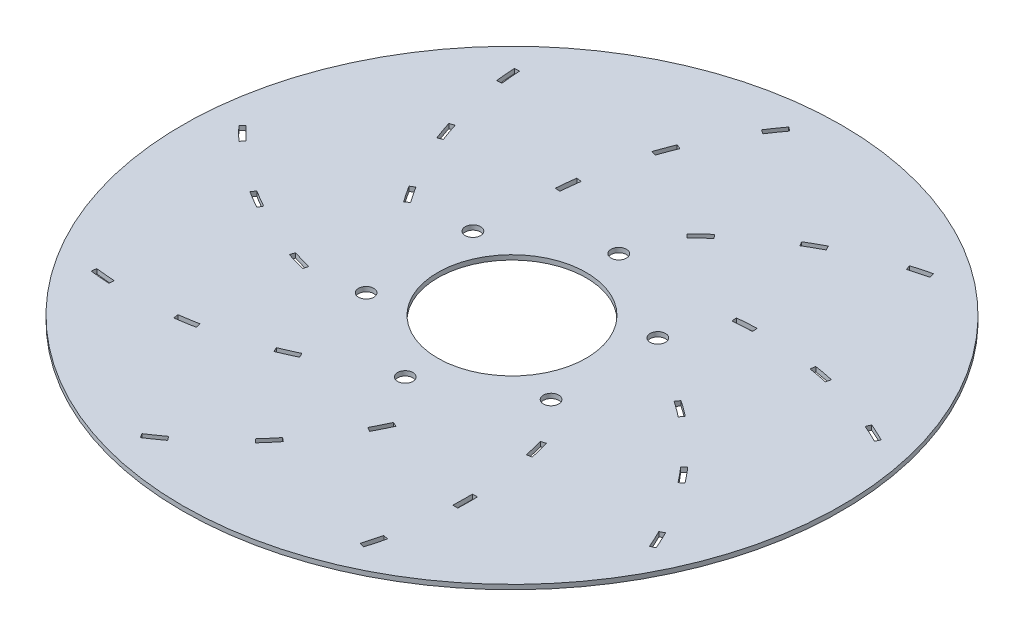
from build123d import *

# Parameters (mm, degrees)
SKETCH2_R                = 177.5
SKETCH2_R_2              = 40
SKETCH2_R_3              = 4.15
BASE_FLANGE1_DEPTH       = 2.5
TAB_START                = -2.5
TAB_AND_SLOT_SLOT1_DEPTH = 2.5
CIRPATTERN1_COUNT        = 9


# Read off the part's stored shape, not the designer's step: Tab and Slot-Slot1
# Sheet-metal steps are written as plain solids
with BuildPart() as part:
    # Sketch2 → Base-Flange1 (new body)
    with BuildSketch(Plane(origin=(0, 0, 0), x_dir=(1, 0, 0), z_dir=(0, 1, 0))):
        with Locations(Location((0, 0, 0), (0, 0, 270))):
            Circle(SKETCH2_R)
        with Locations(Location((0, 0, 0), (0, 0, 270))):
            Circle(SKETCH2_R_2, mode=Mode.SUBTRACT)
        with Locations(Location((0, 57.5, 0), (0, 0, 270))):
            Circle(SKETCH2_R_3, mode=Mode.SUBTRACT)
        with Locations(Location((49.796460718, 28.75, 0), (0, 0, 270))):
            Circle(SKETCH2_R_3, mode=Mode.SUBTRACT)
        with Locations(Location((49.796460718, -28.75, 0), (0, 0, 270))):
            Circle(SKETCH2_R_3, mode=Mode.SUBTRACT)
        with Locations(Location((0, -57.5, 0), (0, 0, 270))):
            Circle(SKETCH2_R_3, mode=Mode.SUBTRACT)
        with Locations(Location((-49.796460718, -28.75, 0), (0, 0, 270))):
            Circle(SKETCH2_R_3, mode=Mode.SUBTRACT)
        with Locations(Location((-49.796460718, 28.75, 0), (0, 0, 270))):
            Circle(SKETCH2_R_3, mode=Mode.SUBTRACT)
    extrude(amount=-BASE_FLANGE1_DEPTH)

    # Tab and Slot-Slot1 outline → Tab and Slot-Slot1 (cut)
    with BuildSketch(Plane(origin=(0, 0, 0), x_dir=(1, 0, 0), z_dir=(0, 1, 0)).offset(TAB_START)):
        with BuildLine():
            Line((-19.35698036, 153.703677576), (-17.100043029, 152.221707173))
            ThreePointArc((-17.100043029, 152.221707173), (-14.185380107, 156.523975279), (-11.142966591, 160.736871053))
            Line((-11.142966591, 160.736871053), (-13.308830451, 162.349023691))
            ThreePointArc((-13.308830451, 162.349023691), (-16.397738089, 158.071706572), (-19.35698036, 153.703677576))
        make_face()
        with BuildLine():
            ThreePointArc((-36.160055897, 113.251731275), (-34.405862702, 118.143313538), (-32.505717981, 122.980070804))
            Line((-32.505717981, 122.980070804), (-35.004247803, 124.003472544))
            ThreePointArc((-35.004247803, 124.003472544), (-36.933420587, 119.092761343), (-38.714454271, 114.126403408))
            Line((-38.714454271, 114.126403408), (-36.160055897, 113.251731275))
        make_face()
        with BuildLine():
            ThreePointArc((-44.938772946, 70.767884474), (-44.45508819, 75.941937031), (-43.816406366, 81.09915104))
            Line((-43.816406366, 81.09915104), (-46.490871974, 81.469604956))
            ThreePointArc((-46.490871974, 81.469604956), (-47.139294904, 76.233543475), (-47.630397611, 70.980391064))
            Line((-47.630397611, 70.980391064), (-44.938772946, 70.767884474))
        make_face()
    tab_and_slot_slot1 = extrude(amount=TAB_AND_SLOT_SLOT1_DEPTH, mode=Mode.SUBTRACT)

    # CirPattern1: Tab and Slot-Slot1 ×9 about axis
    cirpattern1_axis = Axis((0, 0, 0), (0, 1, 0))
    for i in range(1, CIRPATTERN1_COUNT):
        add(tab_and_slot_slot1.rotate(cirpattern1_axis, i * 360 / CIRPATTERN1_COUNT), mode=Mode.SUBTRACT)


solid = part.part
